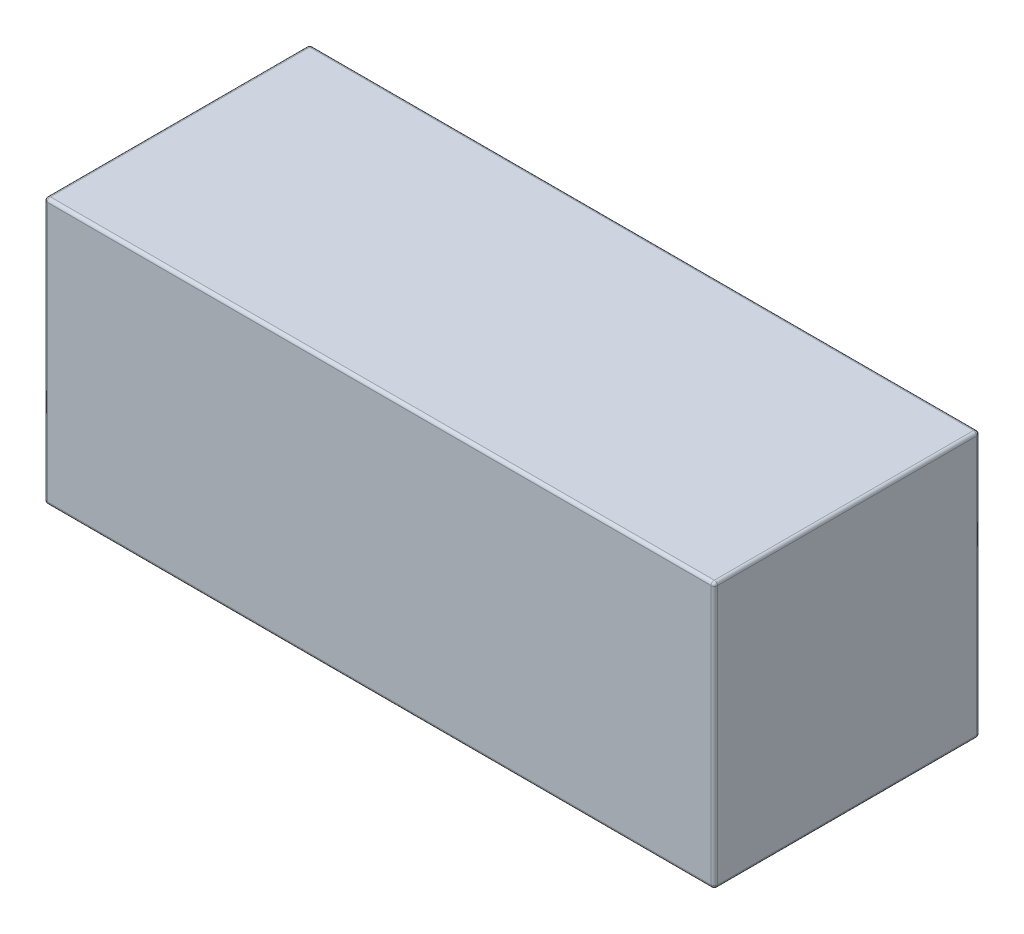
from build123d import *

# Parameters (mm, degrees)
ESQUISSE1_W             = 106
ESQUISSE1_H             = 42
BOSS_EXTRU_1_DEPTH      = 42
ESQUISSE2_W             = 10.5
ESQUISSE2_H             = 10.5
ENL_V_MAT_EXTRU_1_DEPTH = 4.5
CONG_1_R                = 0.5


with BuildPart() as part:
    # Esquisse1 → Boss.-Extru.1 (new body)
    with BuildSketch(Plane.XY):
        with Locations((53, -21)):
            Rectangle(ESQUISSE1_W, ESQUISSE1_H)
    extrude(amount=BOSS_EXTRU_1_DEPTH)

    # Esquisse2 → Enlèv. mat.-Extru.1 (cut)
    with BuildSketch(Plane.XZ.offset(42)):
        with Locations((65, 33)):
            Rectangle(ESQUISSE2_W, ESQUISSE2_H)
        with Locations((94, 9)):
            Rectangle(ESQUISSE2_W, ESQUISSE2_H)
        with Locations((94, 33)):
            Rectangle(ESQUISSE2_W, ESQUISSE2_H)
        with Locations((65, 9)):
            Rectangle(ESQUISSE2_W, ESQUISSE2_H)
    enl_v_mat_extru_1 = extrude(amount=-ENL_V_MAT_EXTRU_1_DEPTH, mode=Mode.SUBTRACT)

    # Congé1
    cong_1_edges = [part.edges().sort_by_distance(p)[0] for p in [
        (0, -42, 21),
        (53, -42, 42),
        (0, -21, 42),
        (106, -42, 21),
        (106, -21, 42),
        (53, -42, 0),
        (106, -21, 0),
        (0, -21, 0),
        (106, 0, 21),
        (53, 0, 42),
        (0, 0, 21),
        (53, 0, 0),
    ]]
    fillet(cong_1_edges, radius=CONG_1_R)

    # Symétrie1: Enlèv. mat.-Extru.1 across plane
    add(enl_v_mat_extru_1.mirror(Plane(origin=(53, 0, 0), x_dir=(0, 0, 1), z_dir=(1, 0, 0))), mode=Mode.SUBTRACT)


solid = part.part
